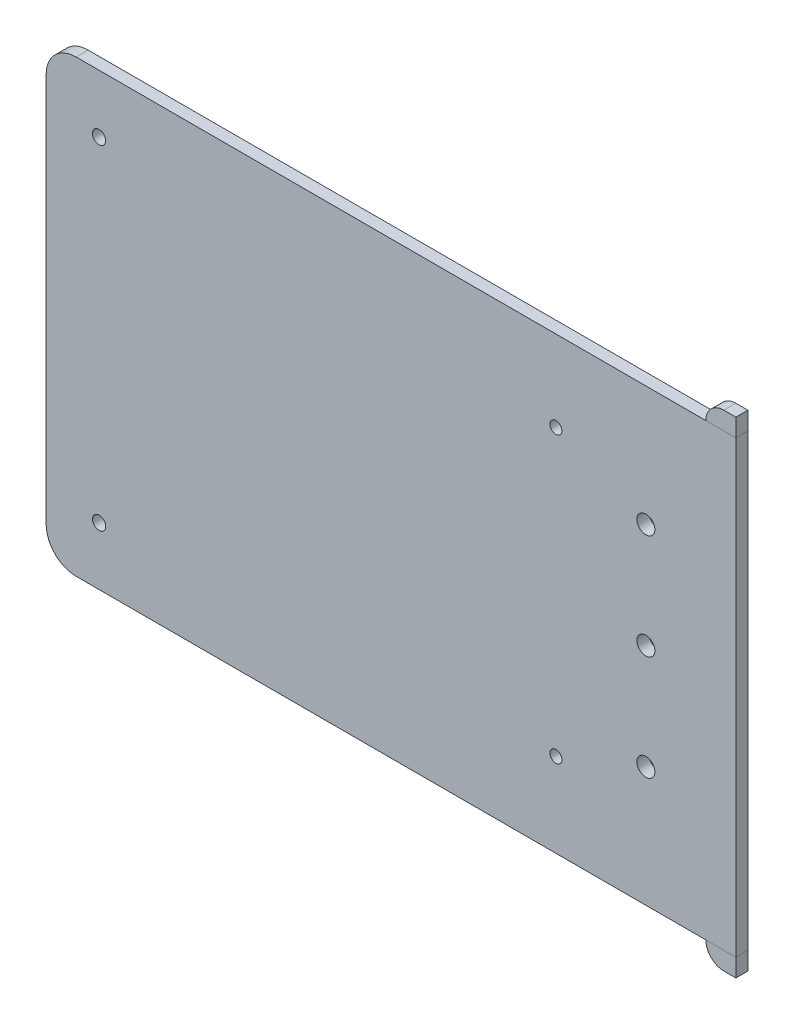
from build123d import *

# Parameters (mm, degrees)
SKETCH1_W             = 230
SKETCH1_H             = 75
BOSS_EXTRUDE1_DEPTH   = 2
CUT_EXTRUDE1_DEPTH    = 1
FILLET1_R             = 5
SKETCH4_W             = 115
SKETCH4_H             = 3
BOSS_EXTRUDE2_DEPTH   = 2
BOSS_EXTRUDE2_2_DEPTH = 2
FILLET4_R             = 3
FILLET5_R             = 3
FILLET6_R             = 3
SKETCH5_R             = 1.1
CUT_EXTRUDE2_DEPTH    = 243.874453259
SKETCH6_R             = 1.5
CUT_EXTRUDE3_DEPTH    = 243.874453259
SKETCH7_R             = 1.5
CUT_EXTRUDE4_DEPTH    = 243.874453259
SKETCH8_R             = 1
CUT_EXTRUDE5_DEPTH    = 243.874453259
SKETCH10_W            = 115
SKETCH10_H            = 122.106823393
CUT_EXTRUDE7_DEPTH    = 10


with BuildPart() as part:
    # Sketch1 → Boss-Extrude1 (new body)
    with BuildSketch(Plane.XY):
        with Locations((115, 37.5)):
            Rectangle(SKETCH1_W, SKETCH1_H)
    extrude(amount=BOSS_EXTRUDE1_DEPTH)

    # Sketch2 → Cut-Extrude1 (cut)
    # profile 1 of 6: a face of its own
    with BuildSketch(Plane(origin=(0, 0, 0), x_dir=(-1, 0, 0), z_dir=(0, 0, -1))):
        with BuildLine():
            Line((-12.568483623, 29.103311562), (-12.568483623, 29.786204191))
            add(Edge.make_bspline(
                [(-12.568483623, 29.786204191), (-12.56831064, 29.819633196), (-12.567975355, 29.884426928), (-12.562654622, 29.978639205), (-12.55558121, 30.066912835), (-12.543715943, 30.149091828), (-12.531413227, 30.225710909), (-12.513355784, 30.295992234), (-12.49341068, 30.360524497), (-12.462722431, 30.438014536), (-12.415063194, 30.525937603), (-12.344380016, 30.620438448), (-12.259636594, 30.702584349), (-12.16306478, 30.772432715), (-12.056824841, 30.828487514), (-11.943202564, 30.868527648), (-11.824109507, 30.894250956), (-11.742460206, 30.896863181), (-11.701195963, 30.898183357)],
                knots=[0, 0, 0, 0, 1.00128172, 1.940733171, 2.826250472, 3.653024905, 4.427672124, 5.149348099, 5.824709082, 6.450061444, 7.643590664, 8.808605388, 9.972104426, 11.165284501, 12.367876273, 13.557044126, 14.765369432, 16, 16, 16, 16], degree=3))
            add(Edge.make_bspline(
                [(-11.701195963, 30.898183357), (-11.662545107, 30.897083747), (-11.58659253, 30.894922908), (-11.475694689, 30.874511937), (-11.370237326, 30.84211681), (-11.270310695, 30.797345438), (-11.177774939, 30.73966003), (-11.09291671, 30.670544802), (-11.018943182, 30.587503409), (-10.977603369, 30.5252553), (-10.956604617, 30.493636082)],
                knots=[0, 0, 0, 0, 1.044641374, 2.052818814, 3.038628718, 4.023282556, 5.005660861, 5.98021751, 6.974042014, 8, 8, 8, 8], degree=3))
            add(Edge.make_bspline(
                [(-10.956604617, 30.493636082), (-10.941334675, 30.53339267), (-10.912119494, 30.609456872), (-10.860548157, 30.714192694), (-10.804253114, 30.804100181), (-10.743725887, 30.88093563), (-10.677521759, 30.946302707), (-10.605102849, 31.002914377), (-10.526528446, 31.051856268), (-10.442087333, 31.093505478), (-10.352495359, 31.126221453), (-10.258846799, 31.150267241), (-10.161500655, 31.164490847), (-10.095439613, 31.166431165), (-10.061973207, 31.167414127)],
                knots=[0, 0, 0, 0, 1.272586185, 2.434772614, 3.483318042, 4.437947805, 5.351807173, 6.25737843, 7.180033415, 8.1141739, 9.066731021, 10.025721652, 10.999834114, 12, 12, 12, 12], degree=3))
            add(Edge.make_bspline(
                [(-10.061973207, 31.167414127), (-10.027806196, 31.166437494), (-9.960581644, 31.164515942), (-9.861828495, 31.150332921), (-9.76744625, 31.126335022), (-9.676867921, 31.093222638), (-9.590283418, 31.050303477), (-9.508006409, 30.99731737), (-9.429865717, 30.935008136), (-9.355723433, 30.86458863), (-9.287880913, 30.786111599), (-9.229559225, 30.69962486), (-9.179410885, 30.607497729), (-9.138581895, 30.508552447), (-9.107082356, 30.403041601), (-9.085135841, 30.291023904), (-9.0703235, 30.172683832), (-9.069107322, 30.091473486), (-9.068483623, 30.049825986)],
                knots=[0, 0, 0, 0, 0.978680899, 1.925582087, 2.851223405, 3.764209995, 4.683484765, 5.614004905, 6.562443559, 7.542772147, 8.539900013, 9.527881485, 10.525548727, 11.540192123, 12.58875426, 13.674701727, 14.807505862, 16, 16, 16, 16], degree=3))
            Line((-9.068483623, 30.049825986), (-9.068483623, 29.103311562))
            Line((-9.068483623, 29.103311562), (-12.568483623, 29.103311562))
        make_face()
        with BuildLine():
            Line((-12.209509265, 29.417414127), (-11.087714393, 29.417414127))
            Line((-11.087714393, 29.417414127), (-11.087714393, 29.628451787))
            add(Edge.make_bspline(
                [(-11.087714393, 29.628451787), (-11.088114316, 29.659300582), (-11.088887048, 29.718906742), (-11.091100566, 29.805226637), (-11.097298607, 29.885351659), (-11.103494878, 29.959143481), (-11.113569437, 30.026485959), (-11.125561653, 30.087229711), (-11.138244256, 30.142328661), (-11.159815021, 30.205866718), (-11.191684022, 30.27794976), (-11.241190126, 30.354742992), (-11.300108641, 30.422756808), (-11.36872836, 30.47950191), (-11.443467299, 30.526353464), (-11.523669321, 30.559174451), (-11.607720465, 30.581055226), (-11.665533102, 30.58306194), (-11.694885867, 30.584080793)],
                knots=[0, 0, 0, 0, 1.156917035, 2.235399477, 3.236897345, 4.169954739, 5.01148057, 5.788325709, 6.491867502, 7.129259015, 8.302032419, 9.437271567, 10.542795419, 11.662606952, 12.764338259, 13.836858145, 14.901724648, 16, 16, 16, 16], degree=3))
            add(Edge.make_bspline(
                [(-11.694885867, 30.584080793), (-11.714314185, 30.583563482), (-11.752424953, 30.58254872), (-11.808162146, 30.573935897), (-11.860534663, 30.559980837), (-11.910045149, 30.541081924), (-11.955463151, 30.515263204), (-11.998958856, 30.485335915), (-12.037927086, 30.448386428), (-12.074243921, 30.406630228), (-12.106747368, 30.358853687), (-12.133671436, 30.304027459), (-12.158073587, 30.243568886), (-12.176137774, 30.175837693), (-12.192022395, 30.102237295), (-12.202002808, 30.021771113), (-12.208425299, 29.934949046), (-12.209139883, 29.874792259), (-12.209509265, 29.843696178)],
                knots=[0, 0, 0, 0, 0.911708768, 1.788416306, 2.640049961, 3.452993646, 4.268229297, 5.087074648, 5.92553149, 6.781184137, 7.681934069, 8.628939405, 9.643570426, 10.73771997, 11.914765019, 13.176320755, 14.540391495, 16, 16, 16, 16], degree=3))
            Line((-12.209509265, 29.843696178), (-12.209509265, 29.417414127))
        make_face(mode=Mode.SUBTRACT)
        with BuildLine():
            Line((-10.728740034, 29.417414127), (-9.427457982, 29.417414127))
            Line((-9.427457982, 29.417414127), (-9.427457982, 29.864729832))
            add(Edge.make_bspline(
                [(-9.427457982, 29.864729832), (-9.427879887, 29.896745409), (-9.428693053, 29.958451213), (-9.430600096, 30.047613953), (-9.43781415, 30.130038379), (-9.444469083, 30.205984509), (-9.455848732, 30.275250782), (-9.466588161, 30.338369998), (-9.482530077, 30.394306012), (-9.504440366, 30.459764089), (-9.539516017, 30.532931089), (-9.590761212, 30.612889451), (-9.654005695, 30.682611903), (-9.725934316, 30.74246212), (-9.803926891, 30.791853118), (-9.886963816, 30.827295831), (-9.973430181, 30.849321197), (-10.032399449, 30.851978763), (-10.061973207, 30.853311562)],
                knots=[0, 0, 0, 0, 1.160376723, 2.23647316, 3.230273494, 4.158083346, 4.997711197, 5.773399541, 6.476071462, 7.102777513, 8.27340052, 9.405620712, 10.53304798, 11.669441455, 12.787990954, 13.865552736, 14.929550474, 16, 16, 16, 16], degree=3))
            add(Edge.make_bspline(
                [(-10.061973207, 30.853311562), (-10.080466946, 30.853036304), (-10.117156118, 30.852490226), (-10.17106613, 30.844217284), (-10.223313457, 30.832248958), (-10.274115822, 30.816486329), (-10.32261905, 30.794451023), (-10.369009151, 30.767437585), (-10.414220639, 30.736515905), (-10.472117865, 30.688809603), (-10.537996878, 30.61840727), (-10.601699781, 30.518357699), (-10.653903694, 30.405225908), (-10.675973273, 30.322980769), (-10.687373848, 30.280495056)],
                knots=[0, 0, 0, 0, 0.723302347, 1.434937762, 2.129609326, 2.821140842, 3.513216847, 4.209993937, 4.920569932, 5.655069131, 7.14393391, 8.6716197, 10.280644748, 12, 12, 12, 12], degree=3))
            add(Edge.make_bspline(
                [(-10.687373848, 30.280495056), (-10.690828932, 30.26346596), (-10.698320266, 30.226543368), (-10.70622797, 30.166335787), (-10.71327303, 30.097599919), (-10.718484187, 30.020177041), (-10.723870731, 29.9339692), (-10.725965552, 29.838792281), (-10.728464812, 29.735034967), (-10.728645946, 29.663042594), (-10.728740034, 29.6256473)],
                knots=[0, 0, 0, 0, 0.634451884, 1.375622551, 2.216452059, 3.157844607, 4.20941857, 5.370758133, 6.634282058, 8, 8, 8, 8], degree=3))
            Line((-10.728740034, 29.6256473), (-10.728740034, 29.417414127))
        make_face(mode=Mode.SUBTRACT)
    # profile 2 of 6: a face of its own
    with BuildSketch(Plane(origin=(0, 0, 0), x_dir=(-1, 0, 0), z_dir=(0, 0, -1))):
        with BuildLine():
            add(Edge.make_bspline(
                [(-12.658227213, 33.523183357), (-12.656613367, 33.587998529), (-12.653443641, 33.715300875), (-12.628378854, 33.902222397), (-12.587124838, 34.081208135), (-12.528865359, 34.252360988), (-12.453339265, 34.415030017), (-12.361596689, 34.569674643), (-12.253080096, 34.715831412), (-12.129382946, 34.852494268), (-11.99391438, 34.977162453), (-11.848892711, 35.086559433), (-11.696141244, 35.178846109), (-11.535652011, 35.254392805), (-11.367799711, 35.313701968), (-11.191643617, 35.354618134), (-11.008337498, 35.380757071), (-10.883310555, 35.38381274), (-10.819885867, 35.385362845)],
                knots=[0, 0, 0, 0, 1.065064174, 2.09187391, 3.093564831, 4.079973196, 5.057907931, 6.036227367, 7.030399151, 8.044883615, 9.061699972, 10.052012555, 11.025713132, 11.989727027, 12.962874294, 13.945865945, 14.957962116, 16, 16, 16, 16], degree=3))
            add(Edge.make_bspline(
                [(-10.819885867, 35.385362845), (-10.756928747, 35.383812218), (-10.63283297, 35.380755754), (-10.450684847, 35.354596925), (-10.275611329, 35.313519398), (-10.108002633, 35.255127133), (-9.94783936, 35.179522466), (-9.794972255, 35.08709993), (-9.649563232, 34.977910573), (-9.513161398, 34.853771793), (-9.388385301, 34.718045157), (-9.278327923, 34.573580848), (-9.186001073, 34.420833454), (-9.109610967, 34.261385889), (-9.051537798, 34.09398612), (-9.009258613, 33.919852319), (-8.983379163, 33.738035746), (-8.980303379, 33.614180697), (-8.978740034, 33.551228229)],
                knots=[0, 0, 0, 0, 1.043748596, 2.057349401, 3.045489418, 4.02252776, 4.995289225, 5.97782527, 6.980224157, 8.006516136, 9.032559198, 10.034193337, 11.013412982, 11.987833483, 12.961212594, 13.946489799, 14.956251404, 16, 16, 16, 16], degree=3))
            add(Edge.make_bspline(
                [(-8.978740034, 33.551228229), (-8.980289421, 33.48780391), (-8.983343675, 33.362777694), (-9.009525079, 33.179240659), (-9.050466383, 33.002962915), (-9.108975819, 32.834448564), (-9.18459305, 32.673603634), (-9.276797429, 32.520113551), (-9.38620457, 32.374594404), (-9.510371145, 32.238252658), (-9.645542697, 32.11350346), (-9.790376952, 32.004744084), (-9.942032409, 31.912518971), (-10.100929933, 31.837155638), (-10.266301375, 31.777491179), (-10.439249853, 31.736786361), (-10.618789359, 31.710450408), (-10.741032257, 31.707415562), (-10.803058944, 31.705875665)],
                knots=[0, 0, 0, 0, 1.053102029, 2.075944431, 3.073151272, 4.055350789, 5.033113405, 6.020478099, 7.024410459, 8.052272461, 9.079885166, 10.07527673, 11.055994387, 12.023226415, 12.992069828, 13.970394897, 14.97016774, 16, 16, 16, 16], degree=3))
            add(Edge.make_bspline(
                [(-10.803058944, 31.705875665), (-10.844691613, 31.706410301), (-10.927431737, 31.707472827), (-11.050298337, 31.720264519), (-11.171188995, 31.738826221), (-11.289759943, 31.765428133), (-11.405720927, 31.8002198), (-11.51987169, 31.841271827), (-11.631055414, 31.891411673), (-11.739798806, 31.948092321), (-11.844406711, 32.011354129), (-11.943286295, 32.081229878), (-12.037267291, 32.155265247), (-12.123914295, 32.23642864), (-12.205747952, 32.322045086), (-12.281510669, 32.413503464), (-12.35188562, 32.510245708), (-12.415305961, 32.612688088), (-12.472665095, 32.718306363), (-12.521886946, 32.827183141), (-12.564133008, 32.937839712), (-12.598373833, 33.05079436), (-12.625405869, 33.165747132), (-12.643813223, 33.282948917), (-12.65663754, 33.402306343), (-12.657695042, 33.482717662), (-12.658227213, 33.523183357)],
                knots=[0, 0, 0, 0, 1.037015668, 2.060948919, 3.074880161, 4.083647147, 5.086022904, 6.090072063, 7.104153813, 8.122640571, 9.144368836, 10.147691507, 11.138137339, 12.123020368, 13.103399296, 14.087645067, 15.080126199, 16.082011238, 17.087798457, 18.072939717, 19.057185487, 20.037253025, 21.01195951, 21.997135196, 22.992090687, 24, 24, 24, 24], degree=3))
        make_face()
        with BuildLine():
            add(Edge.make_bspline(
                [(-12.299252854, 33.538608037), (-12.298849376, 33.505392979), (-12.298046277, 33.4392804), (-12.287409683, 33.341002144), (-12.272358407, 33.243986564), (-12.250498675, 33.148421399), (-12.222224062, 33.05410623), (-12.188122647, 32.960999186), (-12.146905977, 32.869419499), (-12.100552823, 32.779481579), (-12.047903055, 32.693262697), (-11.991994144, 32.610555213), (-11.930748771, 32.533510419), (-11.86549146, 32.461069934), (-11.795655879, 32.393413912), (-11.721700646, 32.330572194), (-11.643305886, 32.272596314), (-11.560794225, 32.220183985), (-11.474626344, 32.173541104), (-11.386449402, 32.131779777), (-11.295227136, 32.09716123), (-11.201528801, 32.069738184), (-11.105767305, 32.0464623), (-11.007420904, 32.031861944), (-10.906828633, 32.021120547), (-10.838846391, 32.020361933), (-10.804461188, 32.019978229)],
                knots=[0, 0, 0, 0, 1.008406545, 2.007172654, 2.999155034, 3.989332444, 4.982025741, 5.988181096, 6.998684226, 8.030553839, 9.059268815, 10.065399129, 11.060956322, 12.046057109, 13.024974577, 14.012068307, 14.991706172, 15.984221787, 16.978487447, 17.966117052, 18.945677757, 19.938371053, 20.93015022, 21.936155317, 22.956113857, 24, 24, 24, 24], degree=3))
            add(Edge.make_bspline(
                [(-10.804461188, 32.019978229), (-10.753900116, 32.021256008), (-10.654430848, 32.023769794), (-10.508646302, 32.045685748), (-10.368404778, 32.079712431), (-10.234542169, 32.129044694), (-10.106461545, 32.191977731), (-9.98466135, 32.268743259), (-9.869177513, 32.360044289), (-9.760869697, 32.463693242), (-9.662052217, 32.57703064), (-9.575191133, 32.697320594), (-9.502086422, 32.823611415), (-9.440972527, 32.955175196), (-9.394931861, 33.093135205), (-9.362104887, 33.236606896), (-9.340828793, 33.385593439), (-9.338762378, 33.487119134), (-9.337714393, 33.538608037)],
                knots=[0, 0, 0, 0, 1.032022337, 2.030307203, 3.003823408, 3.974715386, 4.937372378, 5.913284036, 6.909147208, 7.938749767, 8.970518239, 9.975863271, 10.963918693, 11.946286286, 12.933361397, 13.927862637, 14.949112547, 16, 16, 16, 16], degree=3))
            add(Edge.make_bspline(
                [(-9.337714393, 33.538608037), (-9.338189513, 33.573217675), (-9.339131821, 33.641858981), (-9.348636119, 33.743952508), (-9.36384689, 33.84421621), (-9.385855445, 33.942464834), (-9.41303579, 34.038827108), (-9.446750208, 34.133012272), (-9.487165713, 34.224989043), (-9.532207456, 34.315209692), (-9.583373663, 34.401654091), (-9.63852887, 34.48385989), (-9.698693591, 34.560771948), (-9.763074469, 34.633178445), (-9.832695376, 34.700360313), (-9.906201155, 34.763023107), (-9.9847623, 34.819996568), (-10.066936013, 34.872231218), (-10.152475678, 34.919443214), (-10.240895037, 34.959996582), (-10.331719868, 34.994629999), (-10.425016902, 35.022548456), (-10.520576276, 35.044436631), (-10.618534754, 35.059515814), (-10.718693988, 35.070064452), (-10.786437859, 35.070859502), (-10.820586989, 35.07126028)],
                knots=[0, 0, 0, 0, 1.047334373, 2.07717862, 3.100662057, 4.115010574, 5.122652213, 6.129548646, 7.140165612, 8.16200981, 9.179904151, 10.178566626, 11.156366481, 12.133321541, 13.108841334, 14.082538371, 15.054589433, 16.043660176, 17.028268541, 18.009491307, 18.985652105, 19.968123554, 20.954864208, 21.950389976, 22.966808393, 24, 24, 24, 24], degree=3))
            add(Edge.make_bspline(
                [(-10.820586989, 35.07126028), (-10.854502493, 35.070859167), (-10.921780143, 35.070063486), (-11.021240962, 35.059521011), (-11.118494173, 35.044420121), (-11.213157976, 35.022657413), (-11.305256502, 34.99460726), (-11.394703245, 34.960019926), (-11.481831461, 34.919234641), (-11.566425679, 34.872426362), (-11.64760071, 34.819810739), (-11.725202033, 34.762315753), (-11.797778842, 34.698953177), (-11.867098324, 34.631516783), (-11.931773947, 34.558385253), (-11.991555815, 34.479545824), (-12.049137499, 34.396961495), (-12.100097928, 34.308764682), (-12.147395423, 34.218068914), (-12.187747446, 34.124919272), (-12.222404119, 34.03064607), (-12.250583081, 33.934872386), (-12.272274673, 33.837643489), (-12.287423153, 33.739015924), (-12.298042624, 33.639333955), (-12.298848164, 33.572289889), (-12.299252854, 33.538608037)],
                knots=[0, 0, 0, 0, 1.029877221, 2.042951179, 3.035109885, 4.018542222, 4.991021277, 5.957494829, 6.929429462, 7.911425532, 8.892163142, 9.866273635, 10.842761649, 11.81676864, 12.802607151, 13.805177466, 14.821356543, 15.858816981, 16.897175917, 17.927346774, 18.940346092, 19.946830556, 20.957962087, 21.964146003, 22.97721996, 24, 24, 24, 24], degree=3))
        make_face(mode=Mode.SUBTRACT)
    # profile 3 of 6: a face of its own
    with BuildSketch(Plane(origin=(0, 0, 0), x_dir=(-1, 0, 0), z_dir=(0, 0, -1))):
        Polygon((-12.209509265, 35.699465409), (-12.568483623, 35.699465409), (-12.568483623, 37.539208998), (-12.209509265, 37.539208998), (-12.209509265, 36.776388486), (-9.068483623, 36.776388486), (-9.068483623, 36.462285921), (-12.209509265, 36.462285921), align=None)
    # profile 4 of 6: a face of its own
    with BuildSketch(Plane(origin=(0, 0, 0), x_dir=(-1, 0, 0), z_dir=(0, 0, -1))):
        Polygon((-12.209509265, 37.763567973), (-12.568483623, 37.763567973), (-12.568483623, 39.603311562), (-12.209509265, 39.603311562), (-12.209509265, 38.84049105), (-9.068483623, 38.84049105), (-9.068483623, 38.526388486), (-12.209509265, 38.526388486), align=None)
    # profile 5 of 6: a face of its own
    with BuildSketch(Plane(origin=(0, 0, 0), x_dir=(-1, 0, 0), z_dir=(0, 0, -1))):
        with BuildLine():
            add(Edge.make_bspline(
                [(-12.658227213, 41.869337203), (-12.656613367, 41.934152375), (-12.653443641, 42.061454721), (-12.628378854, 42.248376243), (-12.587124838, 42.427361982), (-12.528865359, 42.598514834), (-12.453339265, 42.761183863), (-12.361596689, 42.915828489), (-12.253080096, 43.061985258), (-12.129382946, 43.198648114), (-11.99391438, 43.323316299), (-11.848892711, 43.432713279), (-11.696141244, 43.524999955), (-11.535652011, 43.600546651), (-11.367799711, 43.659855814), (-11.191643617, 43.70077198), (-11.008337498, 43.726910917), (-10.883310555, 43.729966586), (-10.819885867, 43.731516691)],
                knots=[0, 0, 0, 0, 1.065064174, 2.09187391, 3.093564831, 4.079973196, 5.057907931, 6.036227367, 7.030399151, 8.044883615, 9.061699972, 10.052012555, 11.025713132, 11.989727027, 12.962874294, 13.945865945, 14.957962116, 16, 16, 16, 16], degree=3))
            add(Edge.make_bspline(
                [(-10.819885867, 43.731516691), (-10.756928747, 43.729966064), (-10.63283297, 43.7269096), (-10.450684847, 43.700750771), (-10.275611329, 43.659673244), (-10.108002633, 43.601280979), (-9.94783936, 43.525676312), (-9.794972255, 43.433253776), (-9.649563232, 43.324064419), (-9.513161398, 43.199925639), (-9.388385301, 43.064199004), (-9.278327923, 42.919734694), (-9.186001073, 42.7669873), (-9.109610967, 42.607539735), (-9.051537798, 42.440139966), (-9.009258613, 42.266006165), (-8.983379163, 42.084189592), (-8.980303379, 41.960334543), (-8.978740034, 41.897382075)],
                knots=[0, 0, 0, 0, 1.043748596, 2.057349401, 3.045489418, 4.02252776, 4.995289225, 5.97782527, 6.980224157, 8.006516136, 9.032559198, 10.034193337, 11.013412982, 11.987833483, 12.961212594, 13.946489799, 14.956251404, 16, 16, 16, 16], degree=3))
            add(Edge.make_bspline(
                [(-8.978740034, 41.897382075), (-8.980289421, 41.833957756), (-8.983343675, 41.70893154), (-9.009525079, 41.525394505), (-9.050466383, 41.349116761), (-9.108975819, 41.18060241), (-9.18459305, 41.01975748), (-9.276797429, 40.866267398), (-9.38620457, 40.72074825), (-9.510371145, 40.584406504), (-9.645542697, 40.459657306), (-9.790376952, 40.35089793), (-9.942032409, 40.258672817), (-10.100929933, 40.183309484), (-10.266301375, 40.123645025), (-10.439249853, 40.082940207), (-10.618789359, 40.056604255), (-10.741032257, 40.053569408), (-10.803058944, 40.052029511)],
                knots=[0, 0, 0, 0, 1.053102029, 2.075944431, 3.073151272, 4.055350789, 5.033113405, 6.020478099, 7.024410459, 8.052272461, 9.079885166, 10.07527673, 11.055994387, 12.023226415, 12.992069828, 13.970394897, 14.97016774, 16, 16, 16, 16], degree=3))
            add(Edge.make_bspline(
                [(-10.803058944, 40.052029511), (-10.844691613, 40.052564147), (-10.927431737, 40.053626673), (-11.050298337, 40.066418365), (-11.171188995, 40.084980067), (-11.289759943, 40.111581979), (-11.405720927, 40.146373646), (-11.51987169, 40.187425674), (-11.631055414, 40.237565519), (-11.739798806, 40.294246167), (-11.844406711, 40.357507975), (-11.943286295, 40.427383724), (-12.037267291, 40.501419093), (-12.123914295, 40.582582487), (-12.205747952, 40.668198932), (-12.281510669, 40.75965731), (-12.35188562, 40.856399554), (-12.415305961, 40.958841934), (-12.472665095, 41.064460209), (-12.521886946, 41.173336987), (-12.564133008, 41.283993558), (-12.598373833, 41.396948206), (-12.625405869, 41.511900978), (-12.643813223, 41.629102763), (-12.65663754, 41.748460189), (-12.657695042, 41.828871508), (-12.658227213, 41.869337203)],
                knots=[0, 0, 0, 0, 1.037015668, 2.060948919, 3.074880161, 4.083647147, 5.086022904, 6.090072063, 7.104153813, 8.122640571, 9.144368836, 10.147691507, 11.138137339, 12.123020368, 13.103399296, 14.087645067, 15.080126199, 16.082011238, 17.087798457, 18.072939717, 19.057185487, 20.037253025, 21.01195951, 21.997135196, 22.992090687, 24, 24, 24, 24], degree=3))
        make_face()
        with BuildLine():
            add(Edge.make_bspline(
                [(-12.299252854, 41.884761883), (-12.298849376, 41.851546825), (-12.298046277, 41.785434246), (-12.287409683, 41.68715599), (-12.272358407, 41.59014041), (-12.250498675, 41.494575245), (-12.222224062, 41.400260076), (-12.188122647, 41.307153032), (-12.146905977, 41.215573345), (-12.100552823, 41.125635425), (-12.047903055, 41.039416543), (-11.991994144, 40.956709059), (-11.930748771, 40.879664265), (-11.86549146, 40.80722378), (-11.795655879, 40.739567758), (-11.721700646, 40.67672604), (-11.643305886, 40.61875016), (-11.560794225, 40.566337831), (-11.474626344, 40.51969495), (-11.386449402, 40.477933623), (-11.295227136, 40.443315077), (-11.201528801, 40.41589203), (-11.105767305, 40.392616147), (-11.007420904, 40.37801579), (-10.906828633, 40.367274393), (-10.838846391, 40.366515779), (-10.804461188, 40.366132075)],
                knots=[0, 0, 0, 0, 1.008406545, 2.007172654, 2.999155034, 3.989332444, 4.982025741, 5.988181096, 6.998684226, 8.030553839, 9.059268815, 10.065399129, 11.060956322, 12.046057109, 13.024974577, 14.012068307, 14.991706172, 15.984221787, 16.978487447, 17.966117052, 18.945677757, 19.938371053, 20.93015022, 21.936155317, 22.956113857, 24, 24, 24, 24], degree=3))
            add(Edge.make_bspline(
                [(-10.804461188, 40.366132075), (-10.753900116, 40.367409854), (-10.654430848, 40.36992364), (-10.508646302, 40.391839594), (-10.368404778, 40.425866277), (-10.234542169, 40.475198541), (-10.106461545, 40.538131577), (-9.98466135, 40.614897105), (-9.869177513, 40.706198135), (-9.760869697, 40.809847088), (-9.662052217, 40.923184486), (-9.575191133, 41.04347444), (-9.502086422, 41.169765262), (-9.440972527, 41.301329042), (-9.394931861, 41.439289051), (-9.362104887, 41.582760742), (-9.340828793, 41.731747286), (-9.338762378, 41.83327298), (-9.337714393, 41.884761883)],
                knots=[0, 0, 0, 0, 1.032022337, 2.030307203, 3.003823408, 3.974715386, 4.937372378, 5.913284036, 6.909147208, 7.938749767, 8.970518239, 9.975863271, 10.963918693, 11.946286286, 12.933361397, 13.927862637, 14.949112547, 16, 16, 16, 16], degree=3))
            add(Edge.make_bspline(
                [(-9.337714393, 41.884761883), (-9.338189513, 41.919371521), (-9.339131821, 41.988012827), (-9.348636119, 42.090106354), (-9.36384689, 42.190370056), (-9.385855445, 42.28861868), (-9.41303579, 42.384980954), (-9.446750208, 42.479166118), (-9.487165713, 42.571142889), (-9.532207456, 42.661363538), (-9.583373663, 42.747807937), (-9.63852887, 42.830013736), (-9.698693591, 42.906925794), (-9.763074469, 42.979332291), (-9.832695376, 43.046514159), (-9.906201155, 43.109176953), (-9.9847623, 43.166150414), (-10.066936013, 43.218385064), (-10.152475678, 43.26559706), (-10.240895037, 43.306150429), (-10.331719868, 43.340783845), (-10.425016902, 43.368702302), (-10.520576276, 43.390590477), (-10.618534754, 43.40566966), (-10.718693988, 43.416218298), (-10.786437859, 43.417013348), (-10.820586989, 43.417414127)],
                knots=[0, 0, 0, 0, 1.047334373, 2.07717862, 3.100662057, 4.115010574, 5.122652213, 6.129548646, 7.140165612, 8.16200981, 9.179904151, 10.178566626, 11.156366481, 12.133321541, 13.108841334, 14.082538371, 15.054589433, 16.043660176, 17.028268541, 18.009491307, 18.985652105, 19.968123554, 20.954864208, 21.950389976, 22.966808393, 24, 24, 24, 24], degree=3))
            add(Edge.make_bspline(
                [(-10.820586989, 43.417414127), (-10.854502493, 43.417013014), (-10.921780143, 43.416217332), (-11.021240962, 43.405674857), (-11.118494173, 43.390573967), (-11.213157976, 43.368811259), (-11.305256502, 43.340761106), (-11.394703245, 43.306173772), (-11.481831461, 43.265388487), (-11.566425679, 43.218580209), (-11.64760071, 43.165964585), (-11.725202033, 43.108469599), (-11.797778842, 43.045107024), (-11.867098324, 42.977670629), (-11.931773947, 42.904539099), (-11.991555815, 42.82569967), (-12.049137499, 42.743115341), (-12.100097928, 42.654918528), (-12.147395423, 42.56422276), (-12.187747446, 42.471073118), (-12.222404119, 42.376799916), (-12.250583081, 42.281026232), (-12.272274673, 42.183797335), (-12.287423153, 42.08516977), (-12.298042624, 41.985487801), (-12.298848164, 41.918443735), (-12.299252854, 41.884761883)],
                knots=[0, 0, 0, 0, 1.029877221, 2.042951179, 3.035109885, 4.018542222, 4.991021277, 5.957494829, 6.929429462, 7.911425532, 8.892163142, 9.866273635, 10.842761649, 11.81676864, 12.802607151, 13.805177466, 14.821356543, 15.858816981, 16.897175917, 17.927346774, 18.940346092, 19.946830556, 20.957962087, 21.964146003, 22.97721996, 24, 24, 24, 24], degree=3))
        make_face(mode=Mode.SUBTRACT)
    # profile 6 of 6: a face of its own
    with BuildSketch(Plane(origin=(0, 0, 0), x_dir=(-1, 0, 0), z_dir=(0, 0, -1))):
        Polygon((-9.068483623, 44.269978229), (-12.568483623, 44.732017492), (-12.568483623, 44.776889287), (-9.696688752, 46.221901306), (-12.568483623, 47.663407716), (-12.568483623, 47.708980633), (-9.068483623, 48.173824383), (-9.068483623, 47.858319575), (-11.586913111, 47.523183357), (-9.068483623, 46.259761883), (-9.068483623, 46.188948582), (-11.592522085, 44.920619255), (-9.068483623, 44.586184159), align=None)
    extrude(amount=-CUT_EXTRUDE1_DEPTH, mode=Mode.SUBTRACT)

    # Fillet1
    fillet1_edges = [part.edges().sort_by_distance(p)[0] for p in [
        (0, 75, 1),
        (230, 75, 1),
        (230, 0, 1),
        (0, 0, 1),
    ]]
    fillet(fillet1_edges, radius=FILLET1_R)

    # Sketch5 → Cut-Extrude2 (cut, through all)
    with BuildSketch(Plane(origin=(0, 0, 0), x_dir=(-1, 0, 0), z_dir=(0, 0, -1))):
        with Locations((-8.82, 9.65)):
            Circle(SKETCH5_R)
        with Locations((-8.82, 65.35)):
            Circle(SKETCH5_R)
        with Locations((-118.46, 71.81)):
            Circle(SKETCH5_R)
        with Locations((-118.46, 3.19)):
            Circle(SKETCH5_R)
        with Locations((-211.07, 1.6)):
            Circle(SKETCH5_R)
        with Locations((-211.17, 73.4)):
            Circle(SKETCH5_R)
    extrude(amount=-CUT_EXTRUDE2_DEPTH, mode=Mode.SUBTRACT)

    # Sketch6 → Cut-Extrude3 (cut, through all)
    with BuildSketch(Plane(origin=(0, 0, 0), x_dir=(-1, 0, 0), z_dir=(0, 0, -1))):
        with Locations((-186.05, 12)):
            Circle(SKETCH6_R)
        with Locations((-186.05, 63)):
            Circle(SKETCH6_R)
        with Locations((-186.05, 2)):
            Circle(SKETCH6_R)
        with Locations((-186.05, 73)):
            Circle(SKETCH6_R)
    extrude(amount=-CUT_EXTRUDE3_DEPTH, mode=Mode.SUBTRACT)

    # Sketch7 → Cut-Extrude4 (cut, through all)
    with BuildSketch(Plane(origin=(0, 0, 0), x_dir=(-1, 0, 0), z_dir=(0, 0, -1))):
        with Locations((-130, 20)):
            Circle(SKETCH7_R)
        with Locations((-130, 55)):
            Circle(SKETCH7_R)
        with Locations((-100, 20)):
            Circle(SKETCH7_R)
        with Locations((-100, 55)):
            Circle(SKETCH7_R)
        with Locations((-100, 37.5)):
            Circle(SKETCH7_R)
        with Locations((-130, 37.5)):
            Circle(SKETCH7_R)
    extrude(amount=-CUT_EXTRUDE4_DEPTH, mode=Mode.SUBTRACT)

    # Sketch8 → Cut-Extrude5 (cut, through all)
    with BuildSketch(Plane(origin=(0, 0, 0), x_dir=(-1, 0, 0), z_dir=(0, 0, -1))):
        with Locations((-85, 61.5)):
            Circle(SKETCH8_R)
        with Locations((-85, 14)):
            Circle(SKETCH8_R)
        with Locations((-141.75, 14)):
            Circle(SKETCH8_R)
        with Locations((-141.75, 61.5)):
            Circle(SKETCH8_R)
    extrude(amount=-CUT_EXTRUDE5_DEPTH, mode=Mode.SUBTRACT)


with BuildPart() as body_2:
    # Sketch4 → Boss-Extrude2 (new body)
    with BuildSketch(Plane(origin=(0, 0, 0), x_dir=(-1, 0, 0), z_dir=(0, 0, -1))):
        with Locations((-167.5, 76.5)):
            Rectangle(SKETCH4_W, SKETCH4_H)
    extrude(amount=-BOSS_EXTRUDE2_DEPTH)

    # Fillet4
    fillet4_edges = [body_2.edges().sort_by_distance(p)[0] for p in [
        (225, 78, 1),
    ]]
    fillet(fillet4_edges, radius=FILLET4_R - 0.0001)  # a hair under: the kernel refuses the full size

    # Fillet6
    fillet6_edges = [body_2.edges().sort_by_distance(p)[0] for p in [
        (110, 78, 1),
    ]]
    fillet(fillet6_edges, radius=FILLET6_R - 0.0001)  # a hair under: the kernel refuses the full size


with BuildPart() as body_3:
    # Sketch4 → Boss-Extrude2 2 (new body)
    with BuildSketch(Plane(origin=(0, 0, 0), x_dir=(-1, 0, 0), z_dir=(0, 0, -1))):
        with Locations((-167.5, -1.5)):
            Rectangle(SKETCH4_W, SKETCH4_H)
    extrude(amount=-BOSS_EXTRUDE2_2_DEPTH)

    # Fillet5
    fillet5_edges = [body_3.edges().sort_by_distance(p)[0] for p in [
        (110, -3, 1),
        (225, -3, 1),
    ]]
    fillet(fillet5_edges, radius=FILLET5_R - 0.0001)  # a hair under: the kernel refuses the full size


with BuildPart() as cut_extrude7_tool:
    # Sketch10 → Cut-Extrude7 (new body)
    with BuildSketch(Plane(origin=(0, 0, 0), x_dir=(-1, 0, 0), z_dir=(0, 0, -1))):
        with Locations((-172.5, 42.399397982)):
            Rectangle(SKETCH10_W, SKETCH10_H)
    extrude(amount=-CUT_EXTRUDE7_DEPTH)


with BuildPart() as part_1:
    add(part.part)

    # Cut-Extrude7: cut by cut_extrude7_tool
    add(cut_extrude7_tool.part, mode=Mode.SUBTRACT)


with BuildPart() as body_2_1:
    add(body_2.part)

    # Cut-Extrude7: cut by cut_extrude7_tool
    add(cut_extrude7_tool.part, mode=Mode.SUBTRACT)


with BuildPart() as body_3_1:
    add(body_3.part)

    # Cut-Extrude7: cut by cut_extrude7_tool
    add(cut_extrude7_tool.part, mode=Mode.SUBTRACT)


solid = Compound([part_1.part, body_2_1.part, body_3_1.part])
